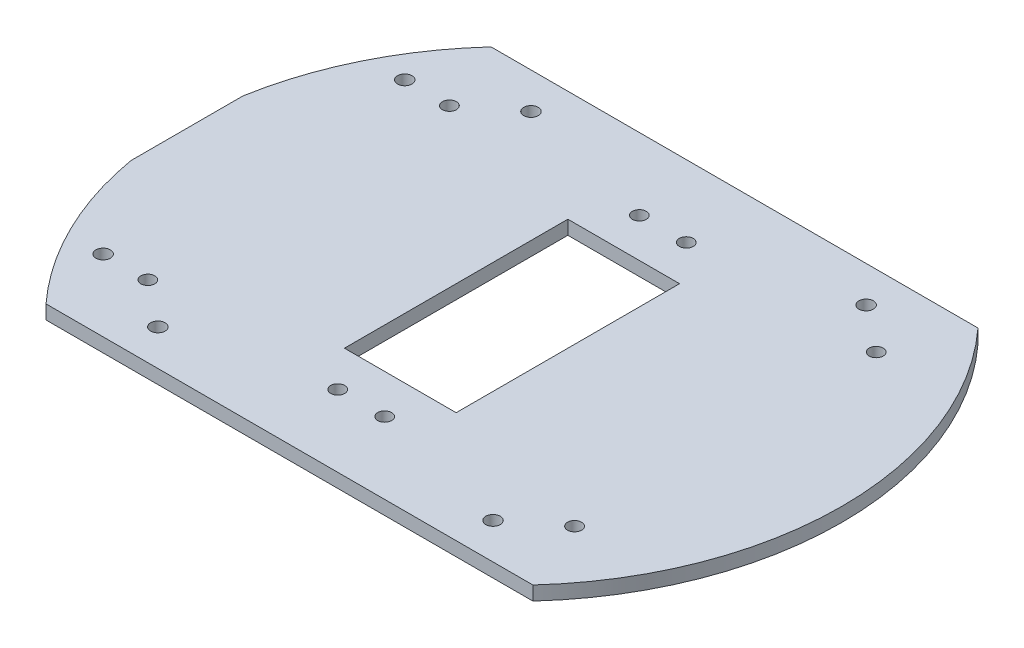
from build123d import *

# Parameters (mm, degrees)
SKETCH1_R           = 1.651
SKETCH1_R_2         = 1.5875
SKETCH1_W           = 25.4
SKETCH1_H           = 50.8
BOSS_EXTRUDE1_DEPTH = 3.175


with BuildPart() as part:
    # Sketch1 → Boss-Extrude1 (new body)
    with BuildSketch(Plane(origin=(0, 0, 0), x_dir=(1, 0, 0), z_dir=(0, 1, 0))):
        with BuildLine():
            Line((-73.916912814, 12.7), (-73.916912814, -12.7))
            ThreePointArc((-73.916912814, -12.7), (-67.357563081, -32.984218889), (-55.35602635, -50.603461806))
            Line((-55.35602635, -50.603461806), (55.35602635, -50.603461806))
            ThreePointArc((55.35602635, -50.603461806), (75, 0), (55.35602635, 50.603461806))
            Line((55.35602635, 50.603461806), (-55.35602635, 50.603461806))
            ThreePointArc((-55.35602635, 50.603461806), (-67.357563081, 32.984218889), (-73.916912814, 12.7))
        make_face()
        with Locations((-58.676912814, -34.29)):
            Circle(SKETCH1_R, mode=Mode.SUBTRACT)
        with Locations((-58.676912814, 34.29)):
            Circle(SKETCH1_R, mode=Mode.SUBTRACT)
        with Locations((-38.1, 42.418)):
            Circle(SKETCH1_R, mode=Mode.SUBTRACT)
        with Locations((38.1, 42.418)):
            Circle(SKETCH1_R, mode=Mode.SUBTRACT)
        with Locations((-38.1, -42.418)):
            Circle(SKETCH1_R, mode=Mode.SUBTRACT)
        with Locations((38.1, -42.418)):
            Circle(SKETCH1_R, mode=Mode.SUBTRACT)
        with Locations((-48.516912814, 34.29)):
            Circle(SKETCH1_R_2, mode=Mode.SUBTRACT)
        with Locations((-5.336912814, 34.29)):
            Circle(SKETCH1_R_2, mode=Mode.SUBTRACT)
        with Locations((-5.336912814, -34.29)):
            Circle(SKETCH1_R_2, mode=Mode.SUBTRACT)
        with Locations((-48.516912814, -34.29)):
            Circle(SKETCH1_R_2, mode=Mode.SUBTRACT)
        with Locations((5.336912814, -34.29)):
            Circle(SKETCH1_R_2, mode=Mode.SUBTRACT)
        with Locations((48.516912814, -34.29)):
            Circle(SKETCH1_R_2, mode=Mode.SUBTRACT)
        with Locations((48.516912814, 34.29)):
            Circle(SKETCH1_R_2, mode=Mode.SUBTRACT)
        with Locations((5.336912814, 34.29)):
            Circle(SKETCH1_R_2, mode=Mode.SUBTRACT)
        Rectangle(SKETCH1_W, SKETCH1_H, mode=Mode.SUBTRACT)
    extrude(amount=BOSS_EXTRUDE1_DEPTH)


solid = part.part
